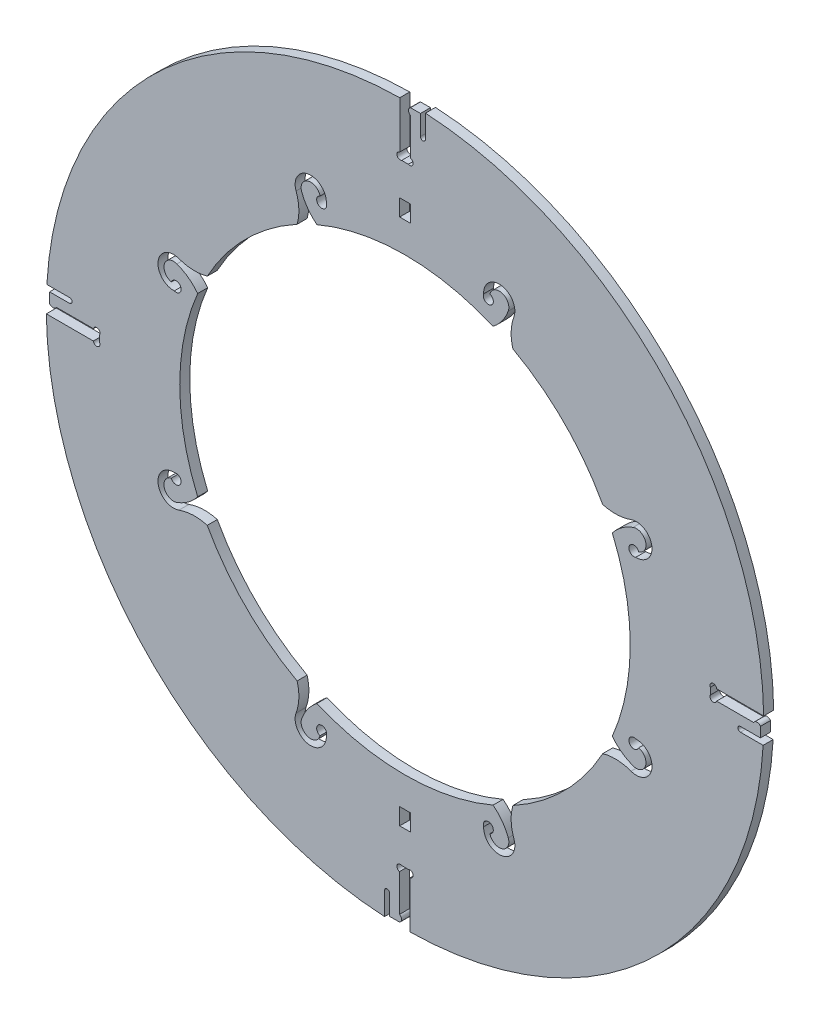
from build123d import *

# Parameters (mm, degrees)
SKETCH1_R                          = 107.5
SKETCH1_R_2                        = 67.5
BOSS_EXTRUDE1_DEPTH                = 3
RIB_SLOT_DEPTH                     = 3
RIB_SLOT_PATTERN_COUNT             = 4
FRONT_BACK_RIB_TAB_CLEARANCE_REACH = 154.041
SKETCH3_W                          = 3.2
SKETCH3_H                          = 5
ELASTIC_ANCHORS_REACH              = 154.041


# Read off the part's stored shape, not the designer's step: rib slot
with BuildPart() as part:
    # Sketch1 → Boss-Extrude1 (new body)
    with BuildSketch(Plane.XY):
        Circle(SKETCH1_R)
        Circle(SKETCH1_R_2, mode=Mode.SUBTRACT)
    extrude(amount=BOSS_EXTRUDE1_DEPTH)

    # rib slot outline → rib slot (cut)
    with BuildSketch(Plane.XY):
        with BuildLine():
            ThreePointArc((-6.135889894, -107.324744841), (-2.287357957, -107.475662331), (1.564110106, -107.488620605))
            Line((1.564110106, -107.488620605), (1.564110106, -93.391745722))
            ThreePointArc((1.564110106, -93.391745722), (2.394190801, -92.114238959), (1, -91.5))
            Line((1, -91.5), (-1, -91.5))
            ThreePointArc((-1, -91.5), (-2.383159214, -92.079561495), (-1.635889894, -93.379795897))
            Line((-1.635889894, -93.379795897), (-1.635889894, -104.5))
            ThreePointArc((-1.635889894, -104.5), (-1.035889894, -105.5), (-1.635889894, -106.5))
            Line((-1.635889894, -106.5), (-4.635889894, -106.5))
            Line((-4.635889894, -106.5), (-4.635889894, -100.5))
            ThreePointArc((-4.635889894, -100.5), (-5.385889894, -99.75), (-6.135889894, -100.5))
            Line((-6.135889894, -100.5), (-6.135889894, -107.324744841))
        make_face()
    rib_slot = extrude(amount=RIB_SLOT_DEPTH, mode=Mode.SUBTRACT)

    # rib slot pattern: rib slot ×4 about axis
    rib_slot_pattern_axis = Axis((0, 0, 0), (0, 0, 1))
    for i in range(1, RIB_SLOT_PATTERN_COUNT):
        add(rib_slot.rotate(rib_slot_pattern_axis, i * 360 / RIB_SLOT_PATTERN_COUNT), mode=Mode.SUBTRACT)

    # Sketch3 → front back rib tab clearance (cut, up to next)
    with BuildSketch(Plane.XY.offset(3), mode=Mode.PRIVATE) as front_back_rib_tab_clearance_sk1:
        with Locations((0, -79)):
            Rectangle(SKETCH3_W, SKETCH3_H)
    front_back_rib_tab_clearance_tool1 = extrude(front_back_rib_tab_clearance_sk1.sketch, amount=-FRONT_BACK_RIB_TAB_CLEARANCE_REACH, mode=Mode.PRIVATE) & part.part
    # Sketch3 → front back rib tab clearance (cut, up to next)
    with BuildSketch(Plane.XY.offset(3), mode=Mode.PRIVATE) as front_back_rib_tab_clearance_sk2:
        with Locations((0, 79)):
            Rectangle(SKETCH3_W, SKETCH3_H)
    front_back_rib_tab_clearance_tool2 = extrude(front_back_rib_tab_clearance_sk2.sketch, amount=-FRONT_BACK_RIB_TAB_CLEARANCE_REACH, mode=Mode.PRIVATE) & part.part
    add(front_back_rib_tab_clearance_tool1.solids().sort_by_distance((0, -79, 3))[0], mode=Mode.SUBTRACT)
    add(front_back_rib_tab_clearance_tool2.solids().sort_by_distance((0, 79, 3))[0], mode=Mode.SUBTRACT)

    # Sketch4 → elastic anchors (cut, up to next)
    with BuildSketch(Plane.XY.offset(3), mode=Mode.PRIVATE) as elastic_anchors_sk1:
        with BuildLine():
            ThreePointArc((-23.570598706, -69.144140951), (-25.601397855, -67.238099637), (-25.446658029, -70.01896178))
            ThreePointArc((-25.446658029, -70.01896178), (-29.075438543, -72.099195538), (-30.948824345, -68.359430018))
            ThreePointArc((-30.948824345, -68.359430018), (-29.143124399, -64.96363906), (-26.471207488, -62.197268051))
            ThreePointArc((-26.471207488, -62.197268051), (-21.930237539, -59.850307494), (-16.846702438, -59.315234774))
            Line((-16.846702438, -59.315234774), (-37.629626544, -51.750869019))
            ThreePointArc((-37.629626544, -51.750869019), (-34.079350843, -55.428391879), (-32.109363213, -60.145147191))
            ThreePointArc((-32.109363213, -60.145147191), (-31.84074512, -63.981785414), (-32.640271063, -67.74379376))
            ThreePointArc((-32.640271063, -67.74379376), (-28.95818762, -73.967017614), (-23.570598706, -69.144140951))
        make_face()
    elastic_anchors_tool1 = extrude(elastic_anchors_sk1.sketch, amount=-ELASTIC_ANCHORS_REACH, mode=Mode.PRIVATE) & part.part
    # Sketch4 → elastic anchors (cut, up to next)
    with BuildSketch(Plane.XY.offset(3), mode=Mode.PRIVATE) as elastic_anchors_sk2:
        with BuildLine():
            ThreePointArc((23.570598706, -69.144140951), (25.601397855, -67.238099637), (25.446658029, -70.01896178))
            ThreePointArc((25.446658029, -70.01896178), (29.075438543, -72.099195538), (30.948824345, -68.359430018))
            ThreePointArc((30.948824345, -68.359430018), (29.143124399, -64.96363906), (26.471207488, -62.197268051))
            ThreePointArc((26.471207488, -62.197268051), (21.930237539, -59.850307494), (16.846702438, -59.315234774))
            Line((16.846702438, -59.315234774), (37.629626544, -51.750869019))
            ThreePointArc((37.629626544, -51.750869019), (34.079350843, -55.428391879), (32.109363213, -60.145147191))
            ThreePointArc((32.109363213, -60.145147191), (31.84074512, -63.981785414), (32.640271063, -67.74379376))
            ThreePointArc((32.640271063, -67.74379376), (28.95818762, -73.967017614), (23.570598706, -69.144140951))
        make_face()
    elastic_anchors_tool2 = extrude(elastic_anchors_sk2.sketch, amount=-ELASTIC_ANCHORS_REACH, mode=Mode.PRIVATE) & part.part
    # Sketch4 → elastic anchors (cut, up to next)
    with BuildSketch(Plane.XY.offset(3), mode=Mode.PRIVATE) as elastic_anchors_sk3:
        with BuildLine():
            ThreePointArc((-69.144140951, 23.570598706), (-67.238099637, 25.601397855), (-70.01896178, 25.446658029))
            ThreePointArc((-70.01896178, 25.446658029), (-72.099195538, 29.075438543), (-68.359430018, 30.948824345))
            ThreePointArc((-68.359430018, 30.948824345), (-64.96363906, 29.143124399), (-62.197268051, 26.471207488))
            ThreePointArc((-62.197268051, 26.471207488), (-59.850307494, 21.930237539), (-59.315234774, 16.846702438))
            Line((-59.315234774, 16.846702438), (-51.750869019, 37.629626544))
            ThreePointArc((-51.750869019, 37.629626544), (-55.428391879, 34.079350843), (-60.145147191, 32.109363213))
            ThreePointArc((-60.145147191, 32.109363213), (-63.981785414, 31.84074512), (-67.74379376, 32.640271063))
            ThreePointArc((-67.74379376, 32.640271063), (-73.967017614, 28.95818762), (-69.144140951, 23.570598706))
        make_face()
    elastic_anchors_tool3 = extrude(elastic_anchors_sk3.sketch, amount=-ELASTIC_ANCHORS_REACH, mode=Mode.PRIVATE) & part.part
    # Sketch4 → elastic anchors (cut, up to next)
    with BuildSketch(Plane.XY.offset(3), mode=Mode.PRIVATE) as elastic_anchors_sk4:
        with BuildLine():
            ThreePointArc((-69.144140951, -23.570598706), (-67.238099637, -25.601397855), (-70.01896178, -25.446658029))
            ThreePointArc((-70.01896178, -25.446658029), (-72.099195538, -29.075438543), (-68.359430018, -30.948824345))
            ThreePointArc((-68.359430018, -30.948824345), (-64.96363906, -29.143124399), (-62.197268051, -26.471207488))
            ThreePointArc((-62.197268051, -26.471207488), (-59.850307494, -21.930237539), (-59.315234774, -16.846702438))
            Line((-59.315234774, -16.846702438), (-51.750869019, -37.629626544))
            ThreePointArc((-51.750869019, -37.629626544), (-55.428391879, -34.079350843), (-60.145147191, -32.109363213))
            ThreePointArc((-60.145147191, -32.109363213), (-63.981785414, -31.84074512), (-67.74379376, -32.640271063))
            ThreePointArc((-67.74379376, -32.640271063), (-73.967017614, -28.95818762), (-69.144140951, -23.570598706))
        make_face()
    elastic_anchors_tool4 = extrude(elastic_anchors_sk4.sketch, amount=-ELASTIC_ANCHORS_REACH, mode=Mode.PRIVATE) & part.part
    # Sketch4 → elastic anchors (cut, up to next)
    with BuildSketch(Plane.XY.offset(3), mode=Mode.PRIVATE) as elastic_anchors_sk5:
        with BuildLine():
            ThreePointArc((23.570598706, 69.144140951), (25.601397855, 67.238099637), (25.446658029, 70.01896178))
            ThreePointArc((25.446658029, 70.01896178), (29.075438543, 72.099195538), (30.948824345, 68.359430018))
            ThreePointArc((30.948824345, 68.359430018), (29.143124399, 64.96363906), (26.471207488, 62.197268051))
            ThreePointArc((26.471207488, 62.197268051), (21.930237539, 59.850307494), (16.846702438, 59.315234774))
            Line((16.846702438, 59.315234774), (37.629626544, 51.750869019))
            ThreePointArc((37.629626544, 51.750869019), (34.079350843, 55.428391879), (32.109363213, 60.145147191))
            ThreePointArc((32.109363213, 60.145147191), (31.84074512, 63.981785414), (32.640271063, 67.74379376))
            ThreePointArc((32.640271063, 67.74379376), (28.95818762, 73.967017614), (23.570598706, 69.144140951))
        make_face()
    elastic_anchors_tool5 = extrude(elastic_anchors_sk5.sketch, amount=-ELASTIC_ANCHORS_REACH, mode=Mode.PRIVATE) & part.part
    # Sketch4 → elastic anchors (cut, up to next)
    with BuildSketch(Plane.XY.offset(3), mode=Mode.PRIVATE) as elastic_anchors_sk6:
        with BuildLine():
            ThreePointArc((-23.570598706, 69.144140951), (-25.601397855, 67.238099637), (-25.446658029, 70.01896178))
            ThreePointArc((-25.446658029, 70.01896178), (-29.075438543, 72.099195538), (-30.948824345, 68.359430018))
            ThreePointArc((-30.948824345, 68.359430018), (-29.143124399, 64.96363906), (-26.471207488, 62.197268051))
            ThreePointArc((-26.471207488, 62.197268051), (-21.930237539, 59.850307494), (-16.846702438, 59.315234774))
            Line((-16.846702438, 59.315234774), (-37.629626544, 51.750869019))
            ThreePointArc((-37.629626544, 51.750869019), (-34.079350843, 55.428391879), (-32.109363213, 60.145147191))
            ThreePointArc((-32.109363213, 60.145147191), (-31.84074512, 63.981785414), (-32.640271063, 67.74379376))
            ThreePointArc((-32.640271063, 67.74379376), (-28.95818762, 73.967017614), (-23.570598706, 69.144140951))
        make_face()
    elastic_anchors_tool6 = extrude(elastic_anchors_sk6.sketch, amount=-ELASTIC_ANCHORS_REACH, mode=Mode.PRIVATE) & part.part
    # Sketch4 → elastic anchors (cut, up to next)
    with BuildSketch(Plane.XY.offset(3), mode=Mode.PRIVATE) as elastic_anchors_sk7:
        with BuildLine():
            ThreePointArc((69.144140951, -23.570598706), (67.238099637, -25.601397855), (70.01896178, -25.446658029))
            ThreePointArc((70.01896178, -25.446658029), (72.099195538, -29.075438543), (68.359430018, -30.948824345))
            ThreePointArc((68.359430018, -30.948824345), (64.96363906, -29.143124399), (62.197268051, -26.471207488))
            ThreePointArc((62.197268051, -26.471207488), (59.850307494, -21.930237539), (59.315234774, -16.846702438))
            Line((59.315234774, -16.846702438), (51.750869019, -37.629626544))
            ThreePointArc((51.750869019, -37.629626544), (55.428391879, -34.079350843), (60.145147191, -32.109363213))
            ThreePointArc((60.145147191, -32.109363213), (63.981785414, -31.84074512), (67.74379376, -32.640271063))
            ThreePointArc((67.74379376, -32.640271063), (73.967017614, -28.95818762), (69.144140951, -23.570598706))
        make_face()
    elastic_anchors_tool7 = extrude(elastic_anchors_sk7.sketch, amount=-ELASTIC_ANCHORS_REACH, mode=Mode.PRIVATE) & part.part
    # Sketch4 → elastic anchors (cut, up to next)
    with BuildSketch(Plane.XY.offset(3), mode=Mode.PRIVATE) as elastic_anchors_sk8:
        with BuildLine():
            ThreePointArc((69.144140951, 23.570598706), (67.238099637, 25.601397855), (70.01896178, 25.446658029))
            ThreePointArc((70.01896178, 25.446658029), (72.099195538, 29.075438543), (68.359430018, 30.948824345))
            ThreePointArc((68.359430018, 30.948824345), (64.96363906, 29.143124399), (62.197268051, 26.471207488))
            ThreePointArc((62.197268051, 26.471207488), (59.850307494, 21.930237539), (59.315234774, 16.846702438))
            Line((59.315234774, 16.846702438), (51.750869019, 37.629626544))
            ThreePointArc((51.750869019, 37.629626544), (55.428391879, 34.079350843), (60.145147191, 32.109363213))
            ThreePointArc((60.145147191, 32.109363213), (63.981785414, 31.84074512), (67.74379376, 32.640271063))
            ThreePointArc((67.74379376, 32.640271063), (73.967017614, 28.95818762), (69.144140951, 23.570598706))
        make_face()
    elastic_anchors_tool8 = extrude(elastic_anchors_sk8.sketch, amount=-ELASTIC_ANCHORS_REACH, mode=Mode.PRIVATE) & part.part
    add(elastic_anchors_tool1.solids().sort_by_distance((-28.423672, -62.033014, 3))[0], mode=Mode.SUBTRACT)
    add(elastic_anchors_tool2.solids().sort_by_distance((28.423672, -62.033014, 3))[0], mode=Mode.SUBTRACT)
    add(elastic_anchors_tool3.solids().sort_by_distance((-62.033014, 28.423672, 3))[0], mode=Mode.SUBTRACT)
    add(elastic_anchors_tool4.solids().sort_by_distance((-62.033014, -28.423672, 3))[0], mode=Mode.SUBTRACT)
    add(elastic_anchors_tool5.solids().sort_by_distance((28.423672, 62.033014, 3))[0], mode=Mode.SUBTRACT)
    add(elastic_anchors_tool6.solids().sort_by_distance((-28.423672, 62.033014, 3))[0], mode=Mode.SUBTRACT)
    add(elastic_anchors_tool7.solids().sort_by_distance((62.033014, -28.423672, 3))[0], mode=Mode.SUBTRACT)
    add(elastic_anchors_tool8.solids().sort_by_distance((62.033014, 28.423672, 3))[0], mode=Mode.SUBTRACT)


solid = part.part
